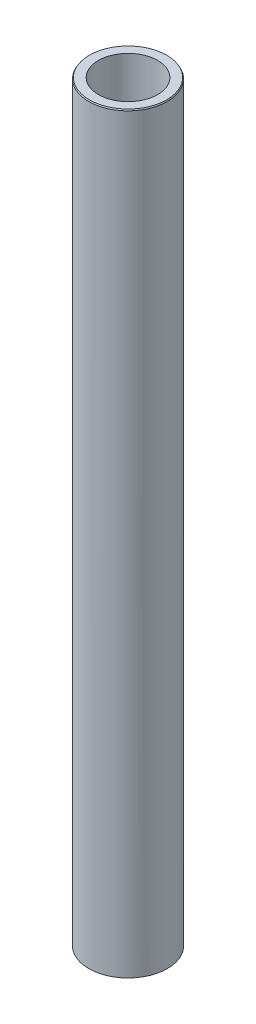
from build123d import *
from OCP.BRepFilletAPI import BRepFilletAPI_MakeChamfer

# Parameters (mm, degrees)
SKETCH1_R           = 22.5
BOSS_EXTRUDE1_DEPTH = 430.901800307
SKETCH2_R           = 16.94951807
CUT_EXTRUDE1_DEPTH  = 433.075064668
CHAMFER1_SIZE       = 0.645397951
CHAMFER1_SIZE2      = 0.372620681


with BuildPart() as part:
    # Sketch1 → Boss-Extrude1 (new body)
    with BuildSketch(Plane(origin=(0, 0, 0), x_dir=(1, 0, 0), z_dir=(0, 1, 0))):
        Circle(SKETCH1_R)
    extrude(amount=BOSS_EXTRUDE1_DEPTH)

    # Sketch2 → Cut-Extrude1 (cut, through all)
    with BuildSketch(Plane(origin=(0, 0, 0), x_dir=(1, 0, 0), z_dir=(0, 1, 0))):
        Circle(SKETCH2_R)
    extrude(amount=CUT_EXTRUDE1_DEPTH, mode=Mode.SUBTRACT)

    # Chamfer1: one chamfer whose edges measure the first distance from different faces: ONE call of the kernel's chamfer builder (chamfer() names one face for all edges)
    chamfer1_edges_1 = [part.edges().sort_by_distance(p)[0] for p in [
        (-22.5, 430.901800307, 0),
    ]]
    chamfer1_side_1 = [part.faces().sort_by_distance(p)[0] for p in [
        (-22.5, 215.450900154, 0),
    ]]
    chamfer1_edges_2 = [part.edges().sort_by_distance(p)[0] for p in [
        (-22.5, 0, 0),
    ]]
    chamfer1_side_2 = [part.faces().sort_by_distance(p)[0] for p in [
        (-21.863603897, 0, 0),
    ]]
    chamfer1 = BRepFilletAPI_MakeChamfer(part.part.solid().wrapped)
    for e in chamfer1_edges_1:
        chamfer1.Add(CHAMFER1_SIZE, CHAMFER1_SIZE2, e.wrapped, chamfer1_side_1[0].wrapped)  # the first distance lies on this face
    for e in chamfer1_edges_2:
        chamfer1.Add(CHAMFER1_SIZE, CHAMFER1_SIZE2, e.wrapped, chamfer1_side_2[0].wrapped)  # the first distance lies on this face
    add(Compound.cast(chamfer1.Shape()), mode=Mode.REPLACE)


solid = part.part
